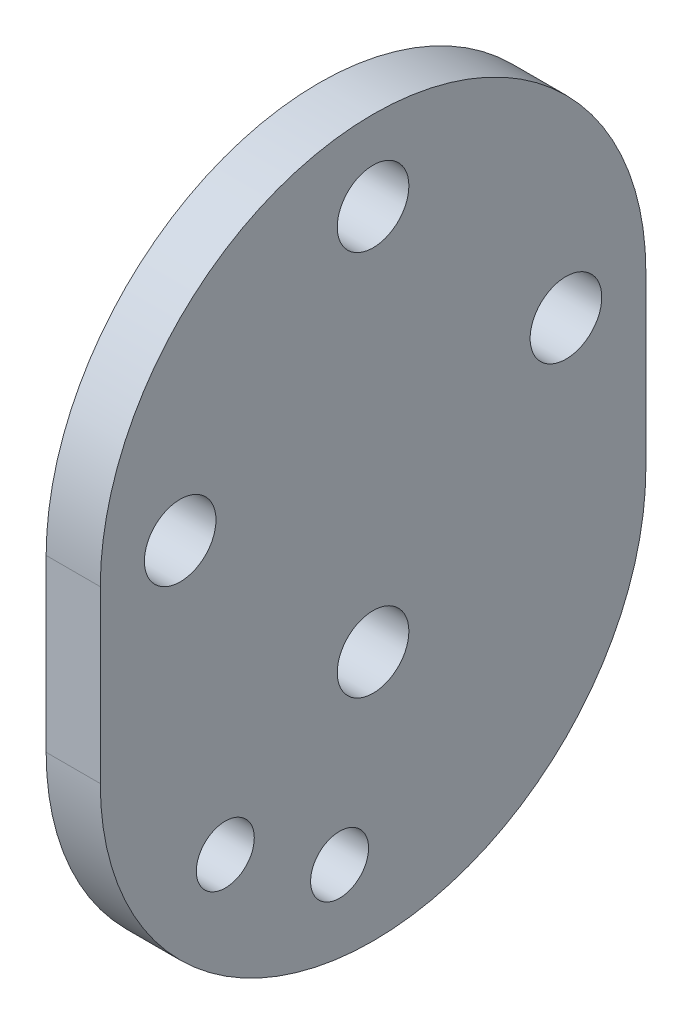
from build123d import *

# Parameters (mm, degrees)
SKETCH2_R           = 1.7
SKETCH2_R_2         = 2.1
BOSS_EXTRUDE1_DEPTH = 3.175


with BuildPart() as part:
    # Sketch2 → Boss-Extrude1 (new body)
    with BuildSketch(Plane(origin=(0, 0, 0), x_dir=(0, 0, -1), z_dir=(1, 0, 0))):
        with BuildLine():
            Line((25.4915032, -0.098674772), (25.4915032, -10.098674772))
            ThreePointArc((25.4915032, -10.098674772), (41.4915032, -26.098674772), (57.4915032, -10.098674772))
            Line((57.4915032, -10.098674772), (57.4915032, -0.098674772))
            ThreePointArc((57.4915032, -0.098674772), (41.4915032, 15.901325228), (25.4915032, -0.098674772))
        make_face()
        with Locations((39.526898337, -21.240502617)):
            Circle(SKETCH2_R, mode=Mode.SUBTRACT)
        with Locations((52.805211699, -0.098674772)):
            Circle(SKETCH2_R_2, mode=Mode.SUBTRACT)
        with Locations((41.4915032, 11.215033727)):
            Circle(SKETCH2_R_2, mode=Mode.SUBTRACT)
        with Locations((30.177794701, -0.098674772)):
            Circle(SKETCH2_R_2, mode=Mode.SUBTRACT)
        with Locations((32.824699674, -17.370986415)):
            Circle(SKETCH2_R, mode=Mode.SUBTRACT)
        with Locations((41.4915032, -11.412383271)):
            Circle(SKETCH2_R_2, mode=Mode.SUBTRACT)
    extrude(amount=BOSS_EXTRUDE1_DEPTH)


solid = part.part
